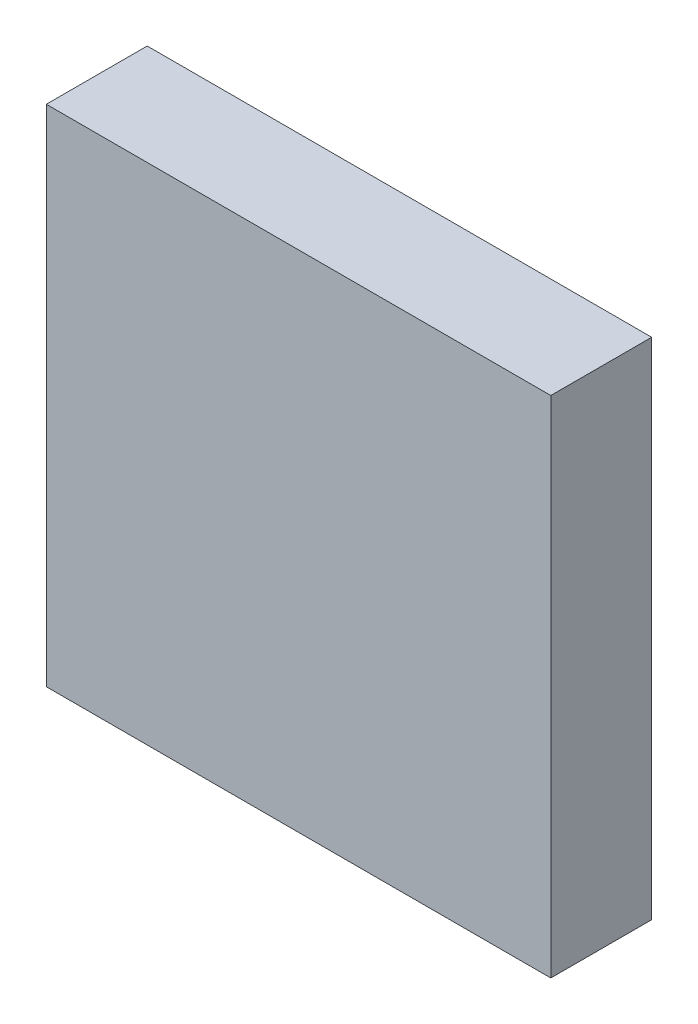
from build123d import *

# Parameters (mm, degrees)
ESBO_O1_W                = 100
ESBO_O1_H                = 100
RESSALTO_EXTRUS_O1_DEPTH = 20
ESBO_O2_W                = 18
ESBO_O2_H                = 18
RESSALTO_EXTRUS_O2_DEPTH = 10


with BuildPart() as part:
    # Esboço1 → Ressalto-extrusão1 (new body)
    with BuildSketch(Plane.XY):
        Rectangle(ESBO_O1_W, ESBO_O1_H)
    extrude(amount=RESSALTO_EXTRUS_O1_DEPTH)

    # Esboço2 → Ressalto-extrusão2 (add)
    with BuildSketch(Plane(origin=(0, 0, 0), x_dir=(-1, 0, 0), z_dir=(0, 0, -1))):
        with Locations((-25, -25)):
            Rectangle(ESBO_O2_W, ESBO_O2_H)
        with Locations((25, -25)):
            Rectangle(ESBO_O2_W, ESBO_O2_H)
        with Locations((-25, 25)):
            Rectangle(ESBO_O2_W, ESBO_O2_H)
        with Locations((25, 25)):
            Rectangle(ESBO_O2_W, ESBO_O2_H)
    extrude(amount=RESSALTO_EXTRUS_O2_DEPTH)


solid = part.part
